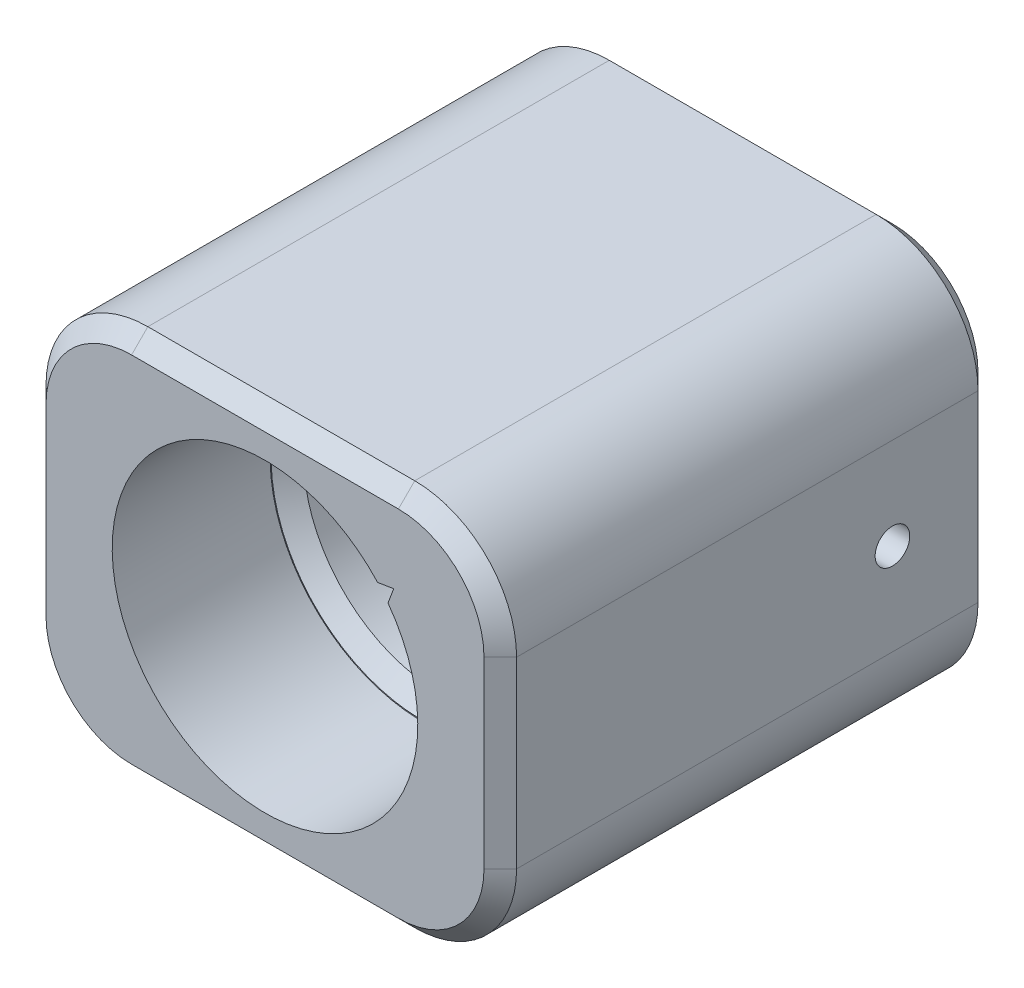
from build123d import *

# Parameters (mm, degrees)
SKETCH2_W           = 46.2
SKETCH2_H           = 38
SKETCH2_R           = 13.3
BOSS_EXTRUDE1_DEPTH = 48.5
SKETCH3_R           = 1.7
CUT_EXTRUDE1_DEPTH  = 70.625354577
SKETCH4_W           = 3.4
SKETCH4_H           = 7
CUT_EXTRUDE2_DEPTH  = 16
CUT_EXTRUDE3_DEPTH  = 15.5
CUT_EXTRUDE4_DEPTH  = 45.537736882
FILLET1_R           = 10
CHAMFER1_SIZE       = 1.6
CHAMFER2_SIZE       = 1.6
CHAMFER3_SIZE       = 1.6
CHAMFER4_SIZE       = 1.6


with BuildPart() as part:
    # Sketch2 → Boss-Extrude1 (new body)
    with BuildSketch(Plane.XY):
        Rectangle(SKETCH2_W, SKETCH2_H)
        with Locations(Location((0, 0, 0), (0, 0, 180))):
            Circle(SKETCH2_R, mode=Mode.SUBTRACT)
    extrude(amount=BOSS_EXTRUDE1_DEPTH)

    # Sketch3 → Cut-Extrude1 (cut, through all)
    with BuildSketch(Plane(origin=(23.1, 0, 0), x_dir=(0, 0, -1), z_dir=(1, 0, 0))):
        with Locations((-10, 0)):
            Circle(SKETCH3_R)
    extrude(amount=-CUT_EXTRUDE1_DEPTH, mode=Mode.SUBTRACT)

    # Sketch4 → Cut-Extrude2 (cut)
    with BuildSketch(Plane(origin=(0, 0, 0), x_dir=(-1, 0, 0), z_dir=(0, 0, -1))):
        with Locations((-17.4, 0)):
            Rectangle(SKETCH4_W, SKETCH4_H)
        with Locations((17.4, 0)):
            Rectangle(SKETCH4_W, SKETCH4_H)
    extrude(amount=-CUT_EXTRUDE2_DEPTH, mode=Mode.SUBTRACT)

    # Sketch1 → Cut-Revolve1 (revolve, cut)
    with BuildSketch(Plane(origin=(0, 0, 0), x_dir=(0, 0, -1), z_dir=(1, 0, 0)), mode=Mode.PRIVATE) as cut_revolve1_sk:
        Polygon((0, 0), (0, 13.3), (-33, 13.3), (-33, 15), (-48.5, 15), (-48.5, 0), align=None)
    revolve(cut_revolve1_sk.sketch.rotate(Axis((0, 0, 1000), (0, 0, -1)), 90), axis=Axis((0, 0, 1000), (0, 0, -1)), mode=Mode.SUBTRACT)

    # Sketch5 → Cut-Extrude3 (cut)
    with BuildSketch(Plane.XY.offset(48.5)):
        Polygon((12.638406773, 10.39522635), (11.06006345, 10.132867141), (12.076444851, 8.897161332), align=None)
    extrude(amount=-CUT_EXTRUDE3_DEPTH, mode=Mode.SUBTRACT)

    # Sketch6 → Cut-Extrude4 (cut, through all)
    with BuildSketch(Plane.XY.offset(33)):
        Polygon((11.32335828, 9.313584733), (9.745014957, 9.051225524), (10.761396359, 7.815519715), align=None)
    extrude(amount=-CUT_EXTRUDE4_DEPTH, mode=Mode.SUBTRACT)

    # Fillet1
    fillet1_edges = [part.edges().sort_by_distance(p)[0] for p in [
        (23.1, -19, 24.25),
        (-23.1, -19, 24.25),
        (-23.1, 19, 24.25),
        (23.1, 19, 24.25),
    ]]
    fillet(fillet1_edges, radius=FILLET1_R)

    # Chamfer1
    chamfer1_edges = [part.edges().sort_by_distance(p)[0] for p in [
        (0, 19, 48.5),
        (-23.1, 0, 48.5),
        (20.171067812, 16.071067812, 48.5),
        (-20.171067812, 16.071067812, 48.5),
        (-20.171067812, -16.071067812, 48.5),
        (20.171067812, -16.071067812, 48.5),
        (23.1, 0, 48.5),
        (0, -19, 48.5),
    ]]
    chamfer(chamfer1_edges, length=CHAMFER1_SIZE)

    # Chamfer2
    # the kernel refuses this chamfer: 1.6 mm, written as the material it takes off along each edge
    with BuildSketch(Plane(origin=(0, 0, 33), x_dir=(-1, 0, 0), z_dir=(0, 1, 0))) as chamfer2_piece_1:
        Polygon((13.3, -CHAMFER2_SIZE), (13.3 + CHAMFER2_SIZE, 0), (13.3, 0), align=None)
    revolve(axis=Axis((0, 0, 33), (0, 0, 1)), revolution_arc=233.756192623, mode=Mode.SUBTRACT)
    with BuildSketch(Plane(origin=(0, 0, 33), x_dir=(0.905245194595796, 0.42488955936951367, 0), z_dir=(0.42488955936951367, -0.905245194595796, 0))) as chamfer2_piece_2:
        Polygon((13.3, -CHAMFER2_SIZE), (13.3 + CHAMFER2_SIZE, 0), (13.3, 0), align=None)
    revolve(axis=Axis((0, 0, 33), (0, 0, 1)), revolution_arc=154.856326918, mode=Mode.SUBTRACT)

    # Chamfer3
    chamfer3_edges = [part.edges().sort_by_distance(p)[0] for p in [
        (15.7, 0, 0),
        (17.4, 3.5, 0),
        (19.1, 0, 0),
        (17.4, -3.5, 0),
        (-17.4, -3.5, 0),
        (-19.1, 0, 0),
        (-17.4, 3.5, 0),
        (-15.7, 0, 0),
    ]]
    chamfer(chamfer3_edges, length=CHAMFER3_SIZE)

    # Chamfer4
    chamfer4_edges = [part.edges().sort_by_distance(p)[0] for p in [
        (23.1, 0, 0),
        (0, -19, 0),
        (-23.1, 0, 0),
        (0, 19, 0),
        (20.171067812, 16.071067812, 0),
        (-20.171067812, 16.071067812, 0),
        (-20.171067812, -16.071067812, 0),
        (20.171067812, -16.071067812, 0),
    ]]
    chamfer(chamfer4_edges, length=CHAMFER4_SIZE)


solid = part.part
